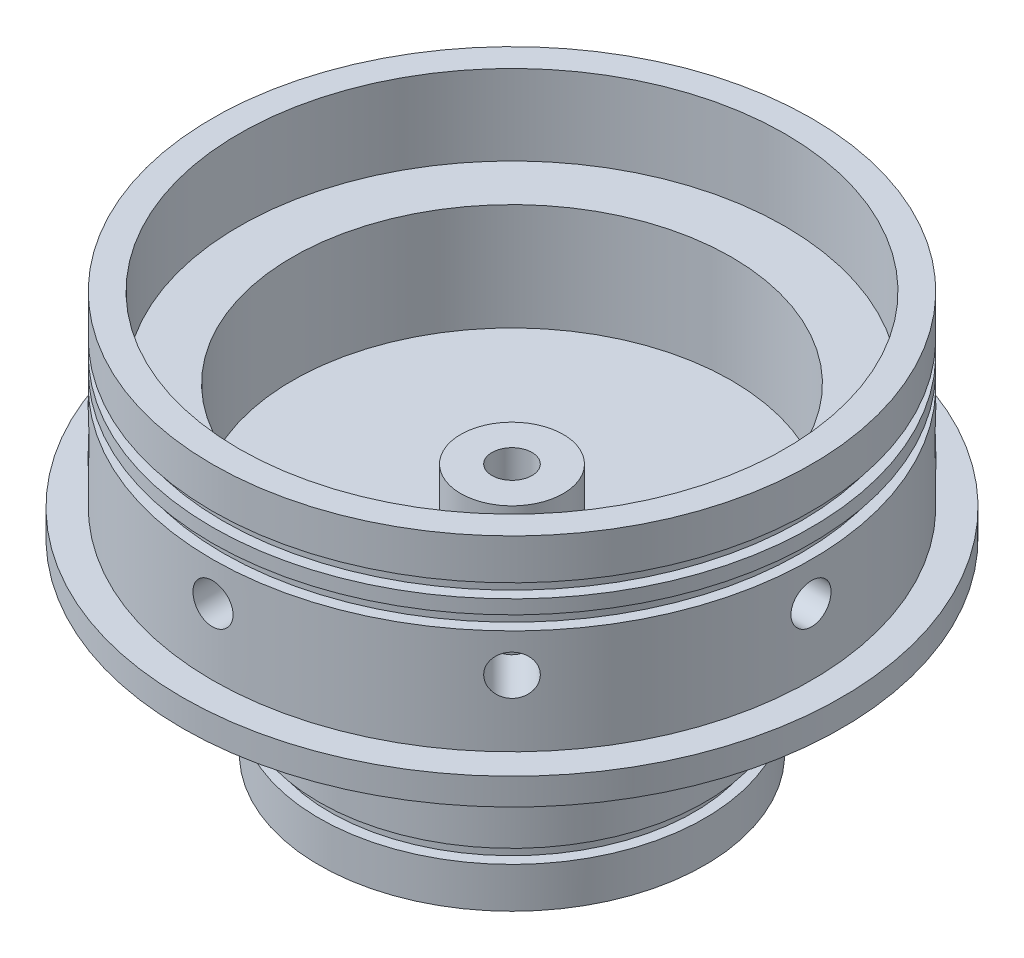
from build123d import *

# Parameters (mm, degrees)
SKETCH1_R              = 78.359
BULKHEADPLATE_DEPTH    = 6.35
SKETCH3_R              = 71.247
SKETCH3_R_2            = 52.197
NOSBASE_DEPTH          = 25.4
SKETCH4_R              = 71.247
SKETCH4_R_2            = 64.897
NOSORINGS_DEPTH        = 19.05
SKETCH5_R              = 45.847
SKETCH5_R_2            = 26.797
ENGINEBASE_DEPTH       = 25.4
SKETCH6_R              = 45.847
SKETCH6_R_2            = 39.497
ENGINEORINGS_DEPTH     = 19.05
NOSBOLTHOLE_DEPTH      = 12.7
NOSBOLTHOLES_COUNT     = 8
SKETCH13_W             = 2.54
SKETCH13_H             = 3.302
SKETCH11_R             = 4.7625
ENGINEBOLTHOLE_DEPTH   = 12.7
ENGINEBOLTHOLES_COUNT  = 8
SKETCH12_W             = 2.54
SKETCH12_H             = 3.302
SKETCH14_R             = 12.192
INJECTORPORT_DEPTH     = 8.89
INJECTORTAP_DEPTH      = 122.905314741
INJECTORTAP_DEPTH_BACK = 122.905314741
SKETCH10_R             = 4.7625


with BuildPart() as part:
    # Sketch1 → BulkheadPlate (new body)
    with BuildSketch(Plane(origin=(0, 0, 0), x_dir=(1, 0, 0), z_dir=(0, 1, 0))):
        Circle(SKETCH1_R)
    extrude(amount=BULKHEADPLATE_DEPTH)

    # Sketch3 → NosBase (add)
    with BuildSketch(Plane(origin=(0, 6.35, 0), x_dir=(1, 0, 0), z_dir=(0, 1, 0))):
        Circle(SKETCH3_R)
        Circle(SKETCH3_R_2, mode=Mode.SUBTRACT)
    extrude(amount=NOSBASE_DEPTH)

    # Sketch4 → NosORings (add)
    with BuildSketch(Plane(origin=(0, 31.75, 0), x_dir=(1, 0, 0), z_dir=(0, 1, 0))):
        Circle(SKETCH4_R)
        Circle(SKETCH4_R_2, mode=Mode.SUBTRACT)
    extrude(amount=NOSORINGS_DEPTH)

    # Sketch5 → EngineBase (add)
    with BuildSketch(Plane.XZ):
        Circle(SKETCH5_R)
        Circle(SKETCH5_R_2, mode=Mode.SUBTRACT)
    extrude(amount=ENGINEBASE_DEPTH)

    # Sketch6 → EngineORings (add)
    with BuildSketch(Plane(origin=(0, -25.4, 0), x_dir=(-1, 0, 0), z_dir=(0, -1, 0))):
        Circle(SKETCH6_R)
        Circle(SKETCH6_R_2, mode=Mode.SUBTRACT)
    extrude(amount=ENGINEORINGS_DEPTH)

    # Sketch7 → NosBoltHole (cut)
    with BuildSketch(Plane.XY.offset(71.247)):
        with BuildLine():
            ThreePointArc((0, 17.352324388), (3.367596045, 18.747228342), (4.7625, 22.114824388))
            ThreePointArc((4.7625, 22.114824388), (-3.367596045, 25.482420433), (0, 17.352324388))
        make_face()
    nosbolthole = extrude(amount=-NOSBOLTHOLE_DEPTH, mode=Mode.SUBTRACT)

    # NosBoltHoles: NosBoltHole ×8 about axis
    nosboltholes_axis = Axis((0, 0, 0), (0, 1, 0))
    for i in range(1, NOSBOLTHOLES_COUNT):
        add(nosbolthole.rotate(nosboltholes_axis, i * 360 / NOSBOLTHOLES_COUNT), mode=Mode.SUBTRACT)

    # Sketch13 → NosORingChannel (revolve, cut)
    with BuildSketch(Plane.XY):
        with Locations((-69.977, 39.497)):
            Rectangle(SKETCH13_W, SKETCH13_H)
        with Locations((-69.977, 32.893)):
            Rectangle(SKETCH13_W, SKETCH13_H)
    revolve(axis=Axis((0, 0, 0), (0, 1, 0)), mode=Mode.SUBTRACT)

    # Sketch11 → EngineBoltHole (cut)
    with BuildSketch(Plane.XY.offset(45.847)):
        with Locations((0, -15.875)):
            Circle(SKETCH11_R)
    enginebolthole = extrude(amount=-ENGINEBOLTHOLE_DEPTH, mode=Mode.SUBTRACT)

    # EngineBoltHoles: EngineBoltHole ×8 about axis
    engineboltholes_axis = Axis((0, 0, 0), (0, 1, 0))
    for i in range(1, ENGINEBOLTHOLES_COUNT):
        add(enginebolthole.rotate(engineboltholes_axis, i * 360 / ENGINEBOLTHOLES_COUNT), mode=Mode.SUBTRACT)

    # Sketch12 → EngineORingChannel (revolve, cut)
    with BuildSketch(Plane.XY):
        with Locations((-44.577, -33.147)):
            Rectangle(SKETCH12_W, SKETCH12_H)
    revolve(axis=Axis((0, 0, 0), (0, -1, 0)), mode=Mode.SUBTRACT)

    # Sketch14 → InjectorPort (add)
    with BuildSketch(Plane(origin=(0, 6.35, 0), x_dir=(1, 0, 0), z_dir=(0, 1, 0))):
        Circle(SKETCH14_R)
    extrude(amount=INJECTORPORT_DEPTH)

    # Sketch10 → InjectorTap (cut, two sides: drawn at the far end of the back side and taken through both)
    with BuildSketch(Plane(origin=(0, 6.35, 0), x_dir=(1, 0, 0), z_dir=(0, 1, 0)).offset(-INJECTORTAP_DEPTH_BACK)):
        Circle(SKETCH10_R)
    extrude(amount=INJECTORTAP_DEPTH + INJECTORTAP_DEPTH_BACK, mode=Mode.SUBTRACT)


solid = part.part
